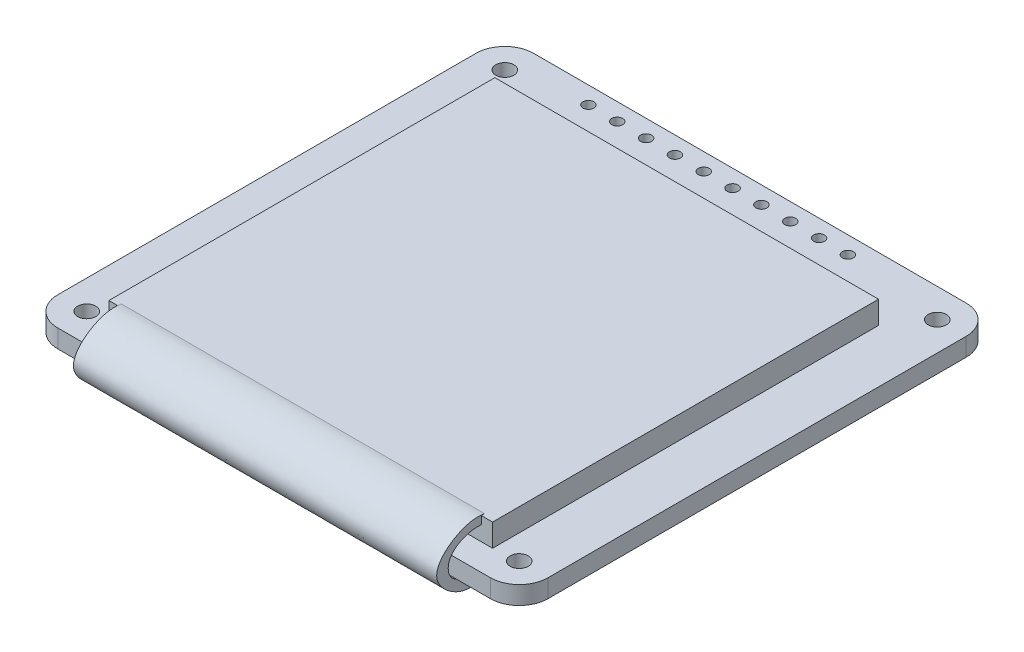
from build123d import *

# Parameters (mm, degrees)
SKETCH1_R           = 0.8
SKETCH1_R_2         = 0.4826
BOSS_EXTRUDE1_DEPTH = 1.6
SKETCH2_W           = 33.8
SKETCH2_H           = 34
BOSS_EXTRUDE2_DEPTH = 2
BOSS_EXTRUDE3_START = 5.5
BOSS_EXTRUDE3_DEPTH = 32


with BuildPart() as part:
    # Sketch1 → Boss-Extrude1 (new body)
    with BuildSketch(Plane(origin=(0, 0, 0), x_dir=(1, 0, 0), z_dir=(0, 1, 0))):
        with BuildLine():
            ThreePointArc((2.54, 41.91), (0.743948776, 41.166051224), (0, 39.37))
            Line((0, 39.37), (0, 2.54))
            ThreePointArc((0, 2.54), (0.743948776, 0.743948776), (2.54, 0))
            Line((2.54, 0), (40.64, 0))
            ThreePointArc((40.64, 0), (42.436051224, 0.743948776), (43.18, 2.54))
            Line((43.18, 2.54), (43.18, 39.37))
            ThreePointArc((43.18, 39.37), (42.436051224, 41.166051224), (40.64, 41.91))
            Line((40.64, 41.91), (2.54, 41.91))
        make_face()
        with Locations((2.54, 2.54)):
            Circle(SKETCH1_R, mode=Mode.SUBTRACT)
        with Locations((40.64, 2.54)):
            Circle(SKETCH1_R, mode=Mode.SUBTRACT)
        with Locations((2.54, 39.37)):
            Circle(SKETCH1_R, mode=Mode.SUBTRACT)
        with Locations((8.89, 40.386)):
            Circle(SKETCH1_R_2, mode=Mode.SUBTRACT)
        with Locations((11.43, 40.386)):
            Circle(SKETCH1_R_2, mode=Mode.SUBTRACT)
        with Locations((13.97, 40.386)):
            Circle(SKETCH1_R_2, mode=Mode.SUBTRACT)
        with Locations((16.51, 40.386)):
            Circle(SKETCH1_R_2, mode=Mode.SUBTRACT)
        with Locations((19.05, 40.386)):
            Circle(SKETCH1_R_2, mode=Mode.SUBTRACT)
        with Locations((21.59, 40.386)):
            Circle(SKETCH1_R_2, mode=Mode.SUBTRACT)
        with Locations((24.13, 40.386)):
            Circle(SKETCH1_R_2, mode=Mode.SUBTRACT)
        with Locations((26.67, 40.386)):
            Circle(SKETCH1_R_2, mode=Mode.SUBTRACT)
        with Locations((29.21, 40.386)):
            Circle(SKETCH1_R_2, mode=Mode.SUBTRACT)
        with Locations((31.75, 40.386)):
            Circle(SKETCH1_R_2, mode=Mode.SUBTRACT)
        with Locations((40.64, 39.37)):
            Circle(SKETCH1_R, mode=Mode.SUBTRACT)
    extrude(amount=BOSS_EXTRUDE1_DEPTH)

    # Sketch2 → Boss-Extrude2 (add)
    with BuildSketch(Plane(origin=(0, 1.6, 0), x_dir=(1, 0, 0), z_dir=(0, 1, 0))):
        with Locations((21.59, 19.343844511)):
            Rectangle(SKETCH2_W, SKETCH2_H)
    extrude(amount=BOSS_EXTRUDE2_DEPTH)

    # Sketch3 → Boss-Extrude3 (add)
    with BuildSketch(Plane(origin=(0, 0, 0), x_dir=(0, 0, -1), z_dir=(1, 0, 0)).offset(BOSS_EXTRUDE3_START)):
        with BuildLine():
            add(Edge.make_bspline(
                [(3.970164527, 3.105314779), (3.04053349, 3.600811343), (1.003377892, 4.056892842), (-2.896061137, 1.167055459), (0.099995748, -1.437870681), (2.983164085, -1.424066333), (8.281609372, -0.229546042), (5.182542742, 2.459112989), (3.970164527, 3.105314779)],
                knots=[0, 0, 0, 0, 0.142117757, 0.339134201, 0.495976707, 0.571841856, 0.814657142, 1, 1, 1, 1], degree=3))
        make_face()
        with BuildLine():
            add(Edge.make_bspline(
                [(4.08176927, 2.23180389), (3.305339462, 2.783945066), (1.536004114, 3.293046243), (-0.859930314, 1.862739832), (-0.461561334, 0.171086046), (1.128981968, -0.665819715), (3.168129753, -0.489558726), (4.994967134, 0.005583457), (5.157624087, 1.295448967), (4.40957126, 1.998694632), (4.08176927, 2.23180389)],
                knots=[0, 0, 0, 0, 0.200568943, 0.386570944, 0.476143886, 0.515165973, 0.747722274, 0.790644782, 0.915321516, 1, 1, 1, 1], degree=3))
        make_face(mode=Mode.SUBTRACT)
    extrude(amount=BOSS_EXTRUDE3_DEPTH)


solid = part.part
